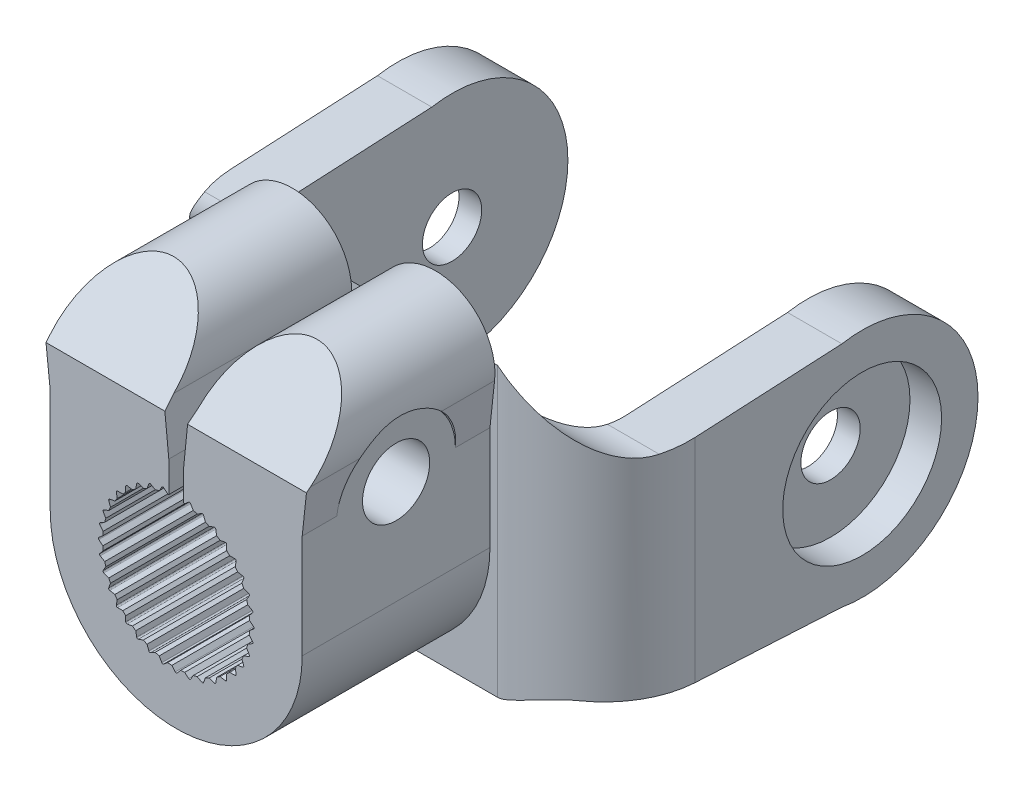
from build123d import *

# Parameters (mm, degrees)
Y_KSEKLIK_EKSTR_ZYON1_DEPTH      = 19
KES_EKSTR_ZYON2_START            = -26
KES_EKSTR_ZYON2_DEPTH            = 26.5
Y_KSEKLIK_EKSTR_ZYON4_DEPTH      = 23.5
Y_KSEKLIK_EKSTR_ZYON4_DEPTH_BACK = 23.5
IZIM7_R                          = 8.04
KES_EKSTR_ZYON3_DEPTH            = 67.156003767
KES_EKSTR_ZYON3_DEPTH_BACK       = 67.156003767
IZIM9_W                          = 36
IZIM9_H                          = 43.420925589
RADYUS4_R                        = 10
RADYUS5_R                        = 5
KES_EKSTR_ZYON4_DEPTH            = 72.402297102
KES_EKSTR_ZYON4_DEPTH_BACK       = 72.402297102
IZIM10_R                         = 3.4
Y_KSEKLIK_EKSTR_ZYON5_START      = -2.3
IZIM13_R                         = 8.04
IZIM13_R_2                       = 3
Y_KSEKLIK_EKSTR_ZYON5_DEPTH      = 2.3
IZIM14_R                         = 8.04
IZIM14_R_2                       = 3
Y_KSEKLIK_EKSTR_ZYON6_DEPTH      = 2.3
IZIM15_R                         = 6
KES_EKSTR_ZYON5_DEPTH            = 10
KES_EKSTR_ZYON6_START            = 10
IZIM16_R                         = 6
KES_EKSTR_ZYON6_DEPTH            = 10


# Read off the part's stored shape, not the designer's step: Kes-Ekstrüzyon2
with BuildPart() as part:
    # Çizim1 → Yükseklik-Ekstrüzyon1 (new body)
    with BuildSketch(Plane.XY):
        with BuildLine():
            Line((1.25, 15.499954464), (0.75, 10.499954464))
            Line((0.75, 10.499954464), (0.75, 8.950475835))
            Line((0.75, 8.950475835), (0.75, 7.386733823))
            Line((0.75, 7.386733823), (0.855884222, 7.386733823))
            Line((0.855884222, 7.386733823), (1.261203123, 7.726836763))
            ThreePointArc((1.261203123, 7.726836763), (1.367470581, 7.755311042), (1.457590549, 7.692208361))
            Line((1.457590549, 7.692208361), (1.722143673, 7.23398891))
            ThreePointArc((1.722143673, 7.23398891), (1.92461807, 7.182772421), (2.125574285, 7.125890003))
            Line((2.125574285, 7.125890003), (2.583793737, 7.390443126))
            ThreePointArc((2.583793737, 7.390443126), (2.69339126, 7.400031667), (2.771184438, 7.322238489))
            Line((2.771184438, 7.322238489), (2.952149432, 6.825041253))
            ThreePointArc((2.952149432, 6.825041253), (3.142654138, 6.739443548), (3.330679849, 6.648529621))
            Line((3.330679849, 6.648529621), (3.827877085, 6.829494615))
            ThreePointArc((3.827877085, 6.829494615), (3.937474608, 6.819906075), (4.000577289, 6.729786106))
            Line((4.000577289, 6.729786106), (4.092455625, 6.208718171))
            ThreePointArc((4.092455625, 6.208718171), (4.265202251, 6.091340093), (4.434584391, 5.96915703))
            Line((4.434584391, 5.96915703), (4.955652325, 6.061035366))
            ThreePointArc((4.955652325, 6.061035366), (5.061919783, 6.032561087), (5.108414624, 5.932852577))
            Line((5.108414624, 5.932852577), (5.108414624, 5.40374633))
            ThreePointArc((5.108414624, 5.40374633), (5.258154352, 5.258154352), (5.40374633, 5.108414624))
            Line((5.40374633, 5.108414624), (5.932852577, 5.108414624))
            ThreePointArc((5.932852577, 5.108414624), (6.032561087, 5.061919783), (6.061035366, 4.955652325))
            Line((6.061035366, 4.955652325), (5.96915703, 4.434584391))
            ThreePointArc((5.96915703, 4.434584391), (6.091340093, 4.265202251), (6.208718171, 4.092455625))
            Line((6.208718171, 4.092455625), (6.729786106, 4.000577289))
            ThreePointArc((6.729786106, 4.000577289), (6.819906075, 3.937474608), (6.829494615, 3.827877085))
            Line((6.829494615, 3.827877085), (6.648529621, 3.330679849))
            ThreePointArc((6.648529621, 3.330679849), (6.739443548, 3.142654138), (6.825041253, 2.952149432))
            Line((6.825041253, 2.952149432), (7.322238489, 2.771184438))
            ThreePointArc((7.322238489, 2.771184438), (7.400031667, 2.69339126), (7.390443126, 2.583793737))
            Line((7.390443126, 2.583793737), (7.125890003, 2.125574285))
            ThreePointArc((7.125890003, 2.125574285), (7.182772421, 1.92461807), (7.23398891, 1.722143673))
            Line((7.23398891, 1.722143673), (7.692208361, 1.457590549))
            ThreePointArc((7.692208361, 1.457590549), (7.755311042, 1.367470581), (7.726836763, 1.261203123))
            Line((7.726836763, 1.261203123), (7.386733823, 0.855884222))
            ThreePointArc((7.386733823, 0.855884222), (7.407856389, 0.648103455), (7.423135474, 0.439811449))
            Line((7.423135474, 0.439811449), (7.828454374, 0.099708509))
            ThreePointArc((7.828454374, 0.099708509), (7.874949216, 0), (7.828454374, -0.099708509))
            Line((7.828454374, -0.099708509), (7.423135474, -0.439811449))
            ThreePointArc((7.423135474, -0.439811449), (7.407856389, -0.648103455), (7.386733823, -0.855884222))
            Line((7.386733823, -0.855884222), (7.726836763, -1.261203123))
            ThreePointArc((7.726836763, -1.261203123), (7.755311042, -1.367470581), (7.692208361, -1.457590549))
            Line((7.692208361, -1.457590549), (7.23398891, -1.722143673))
            ThreePointArc((7.23398891, -1.722143673), (7.182772421, -1.92461807), (7.125890003, -2.125574285))
            Line((7.125890003, -2.125574285), (7.390443126, -2.583793737))
            ThreePointArc((7.390443126, -2.583793737), (7.400031667, -2.69339126), (7.322238489, -2.771184438))
            Line((7.322238489, -2.771184438), (6.825041253, -2.952149432))
            ThreePointArc((6.825041253, -2.952149432), (6.739443548, -3.142654138), (6.648529621, -3.330679849))
            Line((6.648529621, -3.330679849), (6.829494615, -3.827877085))
            ThreePointArc((6.829494615, -3.827877085), (6.819906075, -3.937474608), (6.729786106, -4.000577289))
            Line((6.729786106, -4.000577289), (6.208718171, -4.092455625))
            ThreePointArc((6.208718171, -4.092455625), (6.091340093, -4.265202251), (5.96915703, -4.434584391))
            Line((5.96915703, -4.434584391), (6.061035366, -4.955652325))
            ThreePointArc((6.061035366, -4.955652325), (6.032561087, -5.061919783), (5.932852577, -5.108414624))
            Line((5.932852577, -5.108414624), (5.40374633, -5.108414624))
            ThreePointArc((5.40374633, -5.108414624), (5.258154352, -5.258154352), (5.108414624, -5.40374633))
            Line((5.108414624, -5.40374633), (5.108414624, -5.932852577))
            ThreePointArc((5.108414624, -5.932852577), (5.061919783, -6.032561087), (4.955652325, -6.061035366))
            Line((4.955652325, -6.061035366), (4.434584391, -5.96915703))
            ThreePointArc((4.434584391, -5.96915703), (4.265202251, -6.091340093), (4.092455625, -6.208718171))
            Line((4.092455625, -6.208718171), (4.000577289, -6.729786106))
            ThreePointArc((4.000577289, -6.729786106), (3.937474608, -6.819906075), (3.827877085, -6.829494615))
            Line((3.827877085, -6.829494615), (3.330679849, -6.648529621))
            ThreePointArc((3.330679849, -6.648529621), (3.142654138, -6.739443548), (2.952149432, -6.825041253))
            Line((2.952149432, -6.825041253), (2.771184438, -7.322238489))
            ThreePointArc((2.771184438, -7.322238489), (2.69339126, -7.400031667), (2.583793737, -7.390443126))
            Line((2.583793737, -7.390443126), (2.125574285, -7.125890003))
            ThreePointArc((2.125574285, -7.125890003), (1.92461807, -7.182772421), (1.722143673, -7.23398891))
            Line((1.722143673, -7.23398891), (1.457590549, -7.692208361))
            ThreePointArc((1.457590549, -7.692208361), (1.367470581, -7.755311042), (1.261203123, -7.726836763))
            Line((1.261203123, -7.726836763), (0.855884222, -7.386733823))
            ThreePointArc((0.855884222, -7.386733823), (0.648103455, -7.407856389), (0.439811449, -7.423135474))
            Line((0.439811449, -7.423135474), (0.099708509, -7.828454374))
            ThreePointArc((0.099708509, -7.828454374), (0, -7.874949216), (-0.099708509, -7.828454374))
            Line((-0.099708509, -7.828454374), (-0.439811449, -7.423135474))
            ThreePointArc((-0.439811449, -7.423135474), (-0.648103455, -7.407856389), (-0.855884222, -7.386733823))
            Line((-0.855884222, -7.386733823), (-1.261203123, -7.726836763))
            ThreePointArc((-1.261203123, -7.726836763), (-1.367470581, -7.755311042), (-1.457590549, -7.692208361))
            Line((-1.457590549, -7.692208361), (-1.722143673, -7.23398891))
            ThreePointArc((-1.722143673, -7.23398891), (-1.92461807, -7.182772421), (-2.125574285, -7.125890003))
            Line((-2.125574285, -7.125890003), (-2.583793737, -7.390443126))
            ThreePointArc((-2.583793737, -7.390443126), (-2.69339126, -7.400031667), (-2.771184438, -7.322238489))
            Line((-2.771184438, -7.322238489), (-2.952149432, -6.825041253))
            ThreePointArc((-2.952149432, -6.825041253), (-3.142654138, -6.739443548), (-3.330679849, -6.648529621))
            Line((-3.330679849, -6.648529621), (-3.827877085, -6.829494615))
            ThreePointArc((-3.827877085, -6.829494615), (-3.937474608, -6.819906075), (-4.000577289, -6.729786106))
            Line((-4.000577289, -6.729786106), (-4.092455625, -6.208718171))
            ThreePointArc((-4.092455625, -6.208718171), (-4.265202251, -6.091340093), (-4.434584391, -5.96915703))
            Line((-4.434584391, -5.96915703), (-4.955652325, -6.061035366))
            ThreePointArc((-4.955652325, -6.061035366), (-5.061919783, -6.032561087), (-5.108414624, -5.932852577))
            Line((-5.108414624, -5.932852577), (-5.108414624, -5.40374633))
            ThreePointArc((-5.108414624, -5.40374633), (-5.258154352, -5.258154352), (-5.40374633, -5.108414624))
            Line((-5.40374633, -5.108414624), (-5.932852577, -5.108414624))
            ThreePointArc((-5.932852577, -5.108414624), (-6.032561087, -5.061919783), (-6.061035366, -4.955652325))
            Line((-6.061035366, -4.955652325), (-5.96915703, -4.434584391))
            ThreePointArc((-5.96915703, -4.434584391), (-6.091340093, -4.265202251), (-6.208718171, -4.092455625))
            Line((-6.208718171, -4.092455625), (-6.729786106, -4.000577289))
            ThreePointArc((-6.729786106, -4.000577289), (-6.819906075, -3.937474608), (-6.829494615, -3.827877085))
            Line((-6.829494615, -3.827877085), (-6.648529621, -3.330679849))
            ThreePointArc((-6.648529621, -3.330679849), (-6.739443548, -3.142654138), (-6.825041253, -2.952149432))
            Line((-6.825041253, -2.952149432), (-7.322238489, -2.771184438))
            ThreePointArc((-7.322238489, -2.771184438), (-7.400031667, -2.69339126), (-7.390443126, -2.583793737))
            Line((-7.390443126, -2.583793737), (-7.125890003, -2.125574285))
            ThreePointArc((-7.125890003, -2.125574285), (-7.182772421, -1.92461807), (-7.23398891, -1.722143673))
            Line((-7.23398891, -1.722143673), (-7.692208361, -1.457590549))
            ThreePointArc((-7.692208361, -1.457590549), (-7.755311042, -1.367470581), (-7.726836763, -1.261203123))
            Line((-7.726836763, -1.261203123), (-7.386733823, -0.855884222))
            ThreePointArc((-7.386733823, -0.855884222), (-7.407856389, -0.648103455), (-7.423135474, -0.439811449))
            Line((-7.423135474, -0.439811449), (-7.828454374, -0.099708509))
            ThreePointArc((-7.828454374, -0.099708509), (-7.874949216, 0), (-7.828454374, 0.099708509))
            Line((-7.828454374, 0.099708509), (-7.423135474, 0.439811449))
            ThreePointArc((-7.423135474, 0.439811449), (-7.407856389, 0.648103455), (-7.386733823, 0.855884222))
            Line((-7.386733823, 0.855884222), (-7.726836763, 1.261203123))
            ThreePointArc((-7.726836763, 1.261203123), (-7.755311042, 1.367470581), (-7.692208361, 1.457590549))
            Line((-7.692208361, 1.457590549), (-7.23398891, 1.722143673))
            ThreePointArc((-7.23398891, 1.722143673), (-7.182772421, 1.92461807), (-7.125890003, 2.125574285))
            Line((-7.125890003, 2.125574285), (-7.390443126, 2.583793737))
            ThreePointArc((-7.390443126, 2.583793737), (-7.400031667, 2.69339126), (-7.322238489, 2.771184438))
            Line((-7.322238489, 2.771184438), (-6.825041253, 2.952149432))
            ThreePointArc((-6.825041253, 2.952149432), (-6.739443548, 3.142654138), (-6.648529621, 3.330679849))
            Line((-6.648529621, 3.330679849), (-6.829494615, 3.827877085))
            ThreePointArc((-6.829494615, 3.827877085), (-6.819906075, 3.937474608), (-6.729786106, 4.000577289))
            Line((-6.729786106, 4.000577289), (-6.208718171, 4.092455625))
            ThreePointArc((-6.208718171, 4.092455625), (-6.091340093, 4.265202251), (-5.96915703, 4.434584391))
            Line((-5.96915703, 4.434584391), (-6.061035366, 4.955652325))
            ThreePointArc((-6.061035366, 4.955652325), (-6.032561087, 5.061919783), (-5.932852577, 5.108414624))
            Line((-5.932852577, 5.108414624), (-5.40374633, 5.108414624))
            ThreePointArc((-5.40374633, 5.108414624), (-5.258154352, 5.258154352), (-5.108414624, 5.40374633))
            Line((-5.108414624, 5.40374633), (-5.108414624, 5.932852577))
            ThreePointArc((-5.108414624, 5.932852577), (-5.061919783, 6.032561087), (-4.955652325, 6.061035366))
            Line((-4.955652325, 6.061035366), (-4.434584391, 5.96915703))
            ThreePointArc((-4.434584391, 5.96915703), (-4.265202251, 6.091340093), (-4.092455625, 6.208718171))
            Line((-4.092455625, 6.208718171), (-4.000577289, 6.729786106))
            ThreePointArc((-4.000577289, 6.729786106), (-3.937474608, 6.819906075), (-3.827877085, 6.829494615))
            Line((-3.827877085, 6.829494615), (-3.330679849, 6.648529621))
            ThreePointArc((-3.330679849, 6.648529621), (-3.142654138, 6.739443548), (-2.952149432, 6.825041253))
            Line((-2.952149432, 6.825041253), (-2.771184438, 7.322238489))
            ThreePointArc((-2.771184438, 7.322238489), (-2.69339126, 7.400031667), (-2.583793737, 7.390443126))
            Line((-2.583793737, 7.390443126), (-2.125574285, 7.125890003))
            ThreePointArc((-2.125574285, 7.125890003), (-1.92461807, 7.182772421), (-1.722143673, 7.23398891))
            Line((-1.722143673, 7.23398891), (-1.457590549, 7.692208361))
            ThreePointArc((-1.457590549, 7.692208361), (-1.367470581, 7.755311042), (-1.261203123, 7.726836763))
            Line((-1.261203123, 7.726836763), (-0.855884222, 7.386733823))
            Line((-0.855884222, 7.386733823), (-0.75, 7.386733823))
            Line((-0.75, 7.386733823), (-0.75, 8.952015392))
            Line((-0.75, 8.952015392), (-0.75, 10.499954464))
            Line((-0.75, 10.499954464), (-1.25, 15.499954464))
            ThreePointArc((-1.25, 15.499954464), (-7.574483533, 21.491173909), (-13.214903479, 14.851937112))
            Line((-13.214903479, 14.851937112), (-12.75, 10.499954464))
            Line((-12.75, 10.499954464), (-12.75, 0))
            ThreePointArc((-12.75, 0), (0, -12.75), (12.75, 0))
            Line((12.75, 0), (12.75, 10.499954464))
            Line((12.75, 10.499954464), (13.214903479, 14.851937112))
            ThreePointArc((13.214903479, 14.851937112), (7.574483533, 21.491173909), (1.25, 15.499954464))
        make_face()
    extrude(amount=-Y_KSEKLIK_EKSTR_ZYON1_DEPTH)

    # Kes-Ekstrüzyon2 outline → Kes-Ekstrüzyon2 (cut)
    with BuildSketch(Plane(origin=(12.75, 0, 0), x_dir=(0, 0, -1), z_dir=(1, 0, 0)).offset(KES_EKSTR_ZYON2_START)):
        Polygon((7, 21.499954464), (0, 21.499954464), (0, 14.499954464), align=None)
    extrude(amount=KES_EKSTR_ZYON2_DEPTH, mode=Mode.SUBTRACT)

    # Çizim7 → Yükseklik-Ekstrüzyon4 (add, two sides: drawn at the far end of the back side and taken through both)
    with BuildSketch(Plane(origin=(0, 0, 0), x_dir=(0, 0, -1), z_dir=(1, 0, 0)).offset(-Y_KSEKLIK_EKSTR_ZYON4_DEPTH_BACK)):
        with BuildLine():
            Line((21.100622684, -11.038164951), (43.840841444, -12.288792244))
            ThreePointArc((43.840841444, -12.288792244), (57.636592377, -0.76329808), (43.864355831, 10.79028405))
            Line((43.864355831, 10.79028405), (25.879903731, 9.860300021))
            ThreePointArc((25.879903731, 9.860300021), (21.040144299, 11.620585375), (19, 16.349188459))
            Line((19, 16.349188459), (19, -12.75))
            ThreePointArc((19, -12.75), (19.716219036, -11.484111971), (21.100622684, -11.038164951))
        make_face()
        with Locations((45.914321235, -0.749954464)):
            Circle(IZIM7_R, mode=Mode.SUBTRACT)
    extrude(amount=Y_KSEKLIK_EKSTR_ZYON4_DEPTH + Y_KSEKLIK_EKSTR_ZYON4_DEPTH_BACK)

    # Çizim9 → Kes-Ekstrüzyon3 (cut, two sides: drawn at the far end of the back side and taken through both)
    with BuildSketch(Plane(origin=(0, 8.499311767, 0.439503197), x_dir=(1, 0, 0), z_dir=(0, 0.9986656902512514, 0.051641447646165184)).offset(-KES_EKSTR_ZYON3_DEPTH_BACK)):
        with Locations((0, 44.620609782)):
            Rectangle(IZIM9_W, IZIM9_H)
    extrude(amount=KES_EKSTR_ZYON3_DEPTH + KES_EKSTR_ZYON3_DEPTH_BACK, mode=Mode.SUBTRACT)

    # Radyus4
    radyus4_edges = [part.edges().sort_by_distance(p)[0] for p in [
        (23.5, 1.799594229, -19),
        (-23.5, 1.799594229, -19),
    ]]
    fillet(radyus4_edges, radius=RADYUS4_R)

    # Radyus5
    radyus5_edges = [part.edges().sort_by_distance(p)[0] for p in [
        (-18, -0.264960758, -22.954458301),
        (18, -0.264960758, -22.954458301),
    ]]
    fillet(radyus5_edges, radius=RADYUS5_R)

    # Çizim10 → Kes-Ekstrüzyon4 (cut, two sides: drawn at the far end of the back side and taken through both)
    with BuildSketch(Plane(origin=(12.75, 0, 0), x_dir=(0, 0, -1), z_dir=(1, 0, 0)).offset(-KES_EKSTR_ZYON4_DEPTH_BACK)):
        with Locations((9.5, 10.499954464)):
            Circle(IZIM10_R)
    extrude(amount=KES_EKSTR_ZYON4_DEPTH + KES_EKSTR_ZYON4_DEPTH_BACK, mode=Mode.SUBTRACT)

    # Çizim13 → Yükseklik-Ekstrüzyon5 (add)
    with BuildSketch(Plane(origin=(-18, 0, 0), x_dir=(0, 0, -1), z_dir=(1, 0, 0)).offset(Y_KSEKLIK_EKSTR_ZYON5_START)):
        with Locations((45.914321235, -0.749954464)):
            Circle(IZIM13_R)
        with Locations((45.914321235, -0.749954464)):
            Circle(IZIM13_R_2, mode=Mode.SUBTRACT)
    extrude(amount=Y_KSEKLIK_EKSTR_ZYON5_DEPTH)

    # Çizim14 → Yükseklik-Ekstrüzyon6 (add)
    with BuildSketch(Plane.ZY.offset(-18)):
        with Locations(Location((-45.914321235, -0.749954464, 0), (0, 0, 180))):
            Circle(IZIM14_R)
        with Locations(Location((-45.914321235, -0.749954464, 0), (0, 0, 180))):
            Circle(IZIM14_R_2, mode=Mode.SUBTRACT)
    extrude(amount=-Y_KSEKLIK_EKSTR_ZYON6_DEPTH)

    # Çizim15 → Kes-Ekstrüzyon5 (cut)
    with BuildSketch(Plane(origin=(12.75, 0, 0), x_dir=(0, 0, -1), z_dir=(1, 0, 0))):
        with Locations((9.5, 10.499954464)):
            Circle(IZIM15_R)
    extrude(amount=KES_EKSTR_ZYON5_DEPTH, mode=Mode.SUBTRACT)

    # Çizim16 → Kes-Ekstrüzyon6 (cut)
    with BuildSketch(Plane.ZY.offset(12.75).offset(KES_EKSTR_ZYON6_START)):
        with Locations((-9.5, 10.499954464)):
            Circle(IZIM16_R)
    extrude(amount=-KES_EKSTR_ZYON6_DEPTH, mode=Mode.SUBTRACT)


solid = part.part
